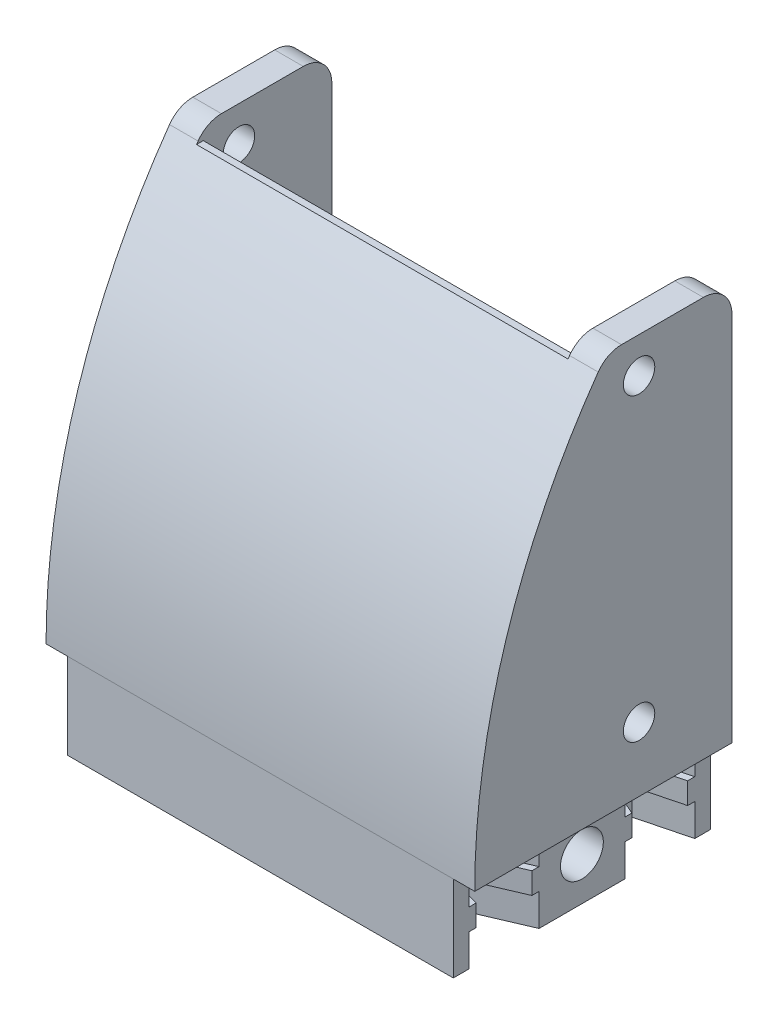
from build123d import *

# Parameters (mm, degrees)
EXTRUDE_1_DEPTH             = 15
CUT_EXTRUDE_1_DEPTH         = 9
FILLET_1_R                  = 2
CUT_EXTRUDE_2_REACH         = 33.337
SKETCH_4_R                  = 1.5000000000000007
CUT_EXTRUDE_3_DEPTH         = 45.068129073061414
SKETCH_6_W                  = 1.5
SKETCH_6_H                  = 6
CUT_EXTRUDE_5_DEPTH         = 39.8587184554509
CUT_EXTRUDE_4_DEPTH         = 6
SKETCH_7_W                  = 22.5
SKETCH_7_H                  = 5
EXTRUDE_2_DEPTH             = 0.5
FILLET_2_R                  = 0.5
HOLE_WIZARD_2_2_2_2_1_D     = 2.2
HOLE_WIZARD_2_2_2_2_1_DEPTH = 2
MIRROR_2_COPY_1_DEPTH       = 6
SKETCH_10_W                 = 26.000000000000004
SKETCH_10_H                 = 2.9999999999999964
CUT_EXTRUDE_6_DEPTH         = 36.59494346111538
EXTRUDE_3_DEPTH             = 0.75
MIRROR_4_COPY_1_DEPTH       = 0.75


with BuildPart() as part:
    # ｽｹｯﾁ1 → ﾎﾞｽ - 押し出し1 (new, symmetric)
    with BuildSketch(Plane(origin=(0, 0, 0), x_dir=(0, 0, -1), z_dir=(1, 0, 0))):
        with BuildLine():
            Line((8.999999999999996, 31.000000000000004), (0.2508278236462402, 31))
            ThreePointArc((0.2508278236462402, 31), (-6.627408015078736, 17.74430242011084), (-9, 3))
            Line((-9, 3), (-9, -3))
            Line((-9, -3), (9, -2.999999999999999))
            Line((9, -2.999999999999999), (8.999999999999996, 31.000000000000004))
        make_face()
    extrude(amount=EXTRUDE_1_DEPTH, both=True)

    # ｽｹｯﾁ2 → ｶｯﾄ - 押し出し1 (cut)
    with BuildSketch(Plane(origin=(0, 9.2e-16, -9), x_dir=(-1, 0, 0), z_dir=(0, 1e-16, -1))):
        Polygon((-13, 31.000000000000004), (13, 31.000000000000004), (13.000000000000002, 5), (-12.999999999999996, 5), align=None)
    extrude(amount=-CUT_EXTRUDE_1_DEPTH, mode=Mode.SUBTRACT)

    # ﾌｨﾚｯﾄ1
    fillet_1_edges = [part.edges().sort_by_distance(p)[0] for p in [
        (-14, 31.000000000000004, -8.999999999999996),
    ]]
    fillet(fillet_1_edges, radius=FILLET_1_R)
    fillet_1_2_edges = [part.edges().sort_by_distance(p)[0] for p in [
        (14, 31.000000000000004, -8.999999999999996),
    ]]
    fillet(fillet_1_2_edges, radius=FILLET_1_R)
    fillet_1_3_edges = [part.edges().sort_by_distance(p)[0] for p in [
        (-14, 31, -0.2508278236462367),
    ]]
    fillet(fillet_1_3_edges, radius=FILLET_1_R)

    # ｽｹｯﾁ3 → ｶｯﾄ - 押し出し2 (cut, up to next)
    with BuildSketch(Plane(origin=(0, 5, 5.1e-16), x_dir=(1, 0, 0), z_dir=(0, 1, 1e-16)), mode=Mode.PRIVATE) as cut_extrude_2_sk1:
        Polygon((-8.749999999999998, 9), (8.750000000000002, 9), (8.750000000000004, 5.999999999999999), (-8.749999999999998, 5.999999999999999), align=None)
    cut_extrude_2_tool1 = extrude(cut_extrude_2_sk1.sketch, amount=-CUT_EXTRUDE_2_REACH, mode=Mode.PRIVATE) & part.part
    add(cut_extrude_2_tool1.solids().sort_by_distance((0, 5, -7.5))[0], mode=Mode.SUBTRACT)

    # ｽｹｯﾁ4 → ｶｯﾄ - 押し出し3 (cut, through all)
    with BuildSketch(Plane(origin=(15, 0, 0), x_dir=(0, 0, -1), z_dir=(1, 0, 0))):
        Circle(SKETCH_4_R)
    extrude(amount=-CUT_EXTRUDE_3_DEPTH, mode=Mode.SUBTRACT)

    # ｽｹｯﾁ6 → ｶｯﾄ - 押し出し5 (cut, through all)
    with BuildSketch(Plane.XY.offset(9)):
        Polygon((-15, 3), (-13.5, 3), (-13.499999999999998, -3), (-15, -3), align=None)
        with Locations((14.250000000000002, 0)):
            Rectangle(SKETCH_6_W, SKETCH_6_H)
    extrude(amount=-CUT_EXTRUDE_5_DEPTH, mode=Mode.SUBTRACT)

    # ｽｹｯﾁ5 → ｶｯﾄ - 押し出し4 (cut)
    with BuildSketch(Plane.XZ.offset(2.9999999999999996)):
        Polygon((13.5, -3), (10, -4.500000000000001), (10, -7), (13.5, -7.9), align=None)
    cut_extrude_4 = extrude(amount=-CUT_EXTRUDE_4_DEPTH, mode=Mode.SUBTRACT)

    # ﾐﾗｰ1: ｶｯﾄ - 押し出し4 across plane
    add(cut_extrude_4.mirror(Plane.XY), mode=Mode.SUBTRACT)

    # ｽｹｯﾁ7 → ﾎﾞｽ - 押し出し2 (add)
    with BuildSketch(Plane.XZ.offset(2.9999999999999996)):
        Rectangle(SKETCH_7_W, SKETCH_7_H)
    extrude(amount=EXTRUDE_2_DEPTH)

    # ﾌｨﾚｯﾄ2
    fillet_2_edges = [part.edges().sort_by_distance(p)[0] for p in [
        (11.250000000000004, -3.2499999999999996, -2.5000000000000004),
        (11.250000000000004, -3.2499999999999996, 2.4999999999999996),
        (-11.249999999999996, -3.2499999999999996, 2.4999999999999996),
        (-11.249999999999996, -3.2499999999999996, -2.5000000000000004),
        (11.250000000000004, -3.4999999999999996, -6.1e-16),
        (3.55e-15, -3.4999999999999996, 2.4999999999999996),
        (-11.249999999999996, -3.4999999999999996, -6.1e-16),
        (3.55e-15, -3.4999999999999996, -2.5000000000000004),
    ]]
    fillet(fillet_2_edges, radius=FILLET_2_R - 0.0001)  # a hair under: the kernel refuses the full size

    # Ø2.2 (2.2) 直径の穴1
    with Locations(Plane(origin=(15, 0, 0), x_dir=(0, 0, -1), z_dir=(1, 0, 0))):
        with Locations((2.5, 28.5), (2.5, 7.5)):
            hole_wizard_2_2_2_2_1 = Hole(HOLE_WIZARD_2_2_2_2_1_D / 2, depth=HOLE_WIZARD_2_2_2_2_1_DEPTH)

    # ﾐﾗｰ2: ｶｯﾄ - 押し出し4, Ø2.2 (2.2) 直径の穴1 across plane
    add(cut_extrude_4.mirror(Plane(origin=(0, 0, 0), x_dir=(0, 0, 1), z_dir=(1, 0, 0))), mode=Mode.SUBTRACT)
    add(hole_wizard_2_2_2_2_1.mirror(Plane(origin=(0, 0, 0), x_dir=(0, 0, 1), z_dir=(1, 0, 0))), mode=Mode.SUBTRACT)

    # ﾐﾗｰ2 copy 1 sketch → ﾐﾗｰ2 copy 1 (cut)
    with BuildSketch(Plane(origin=(0, -2.9999999999999996, 1.4e-16), x_dir=(-1, 0, 0), z_dir=(0, -1, 5e-17))):
        Polygon((13.5, -3), (10, -4.500000000000001), (10, -7), (13.5, -7.9), align=None)
    extrude(amount=-MIRROR_2_COPY_1_DEPTH, mode=Mode.SUBTRACT)

    # ｽｹｯﾁ10 → ｶｯﾄ - 押し出し6 (cut, through all)
    with BuildSketch(Plane(origin=(0, 0, 0), x_dir=(-1, 0, 0), z_dir=(0, 1.3e-16, -1))):
        with Locations((0, 31.5)):
            Rectangle(SKETCH_10_W, SKETCH_10_H)
    extrude(amount=-CUT_EXTRUDE_6_DEPTH, mode=Mode.SUBTRACT)

    # ｽｹｯﾁ12 → ﾎﾞｽ - 押し出し3 (add, symmetric)
    with BuildSketch(Plane(origin=(0, 0, 0), x_dir=(-1, 0, 0), z_dir=(0, -1, -2e-17))):
        Polygon((13.5, -7.9), (9.999999999999998, -7), (10, -6.500000000000001), (13.5, -7.4), align=None)
        Polygon((10, -4.500000000000001), (10, -5), (13.499999999999998, -3.4999999999999982), (13.5, -2.9999999999999996), align=None)
    extrude_3 = extrude(amount=EXTRUDE_3_DEPTH, both=True)

    # ﾐﾗｰ3: ﾎﾞｽ - 押し出し3 across plane
    add(extrude_3.mirror(Plane.XY))

    # ﾐﾗｰ4: ﾎﾞｽ - 押し出し3 across plane
    add(extrude_3.mirror(Plane(origin=(0, 0, 0), x_dir=(0, 0, 1), z_dir=(1, 0, 0))))

    # ﾐﾗｰ4 copy 1 sketch → ﾐﾗｰ4 copy 1 (add, symmetric)
    with BuildSketch(Plane.XZ):
        Polygon((13.5, -7.9), (9.999999999999998, -7), (10, -6.500000000000001), (13.5, -7.4), align=None)
        Polygon((10, -4.500000000000001), (10, -5), (13.499999999999998, -3.4999999999999982), (13.5, -2.9999999999999996), align=None)
    extrude(amount=MIRROR_4_COPY_1_DEPTH, both=True)


solid = part.part
